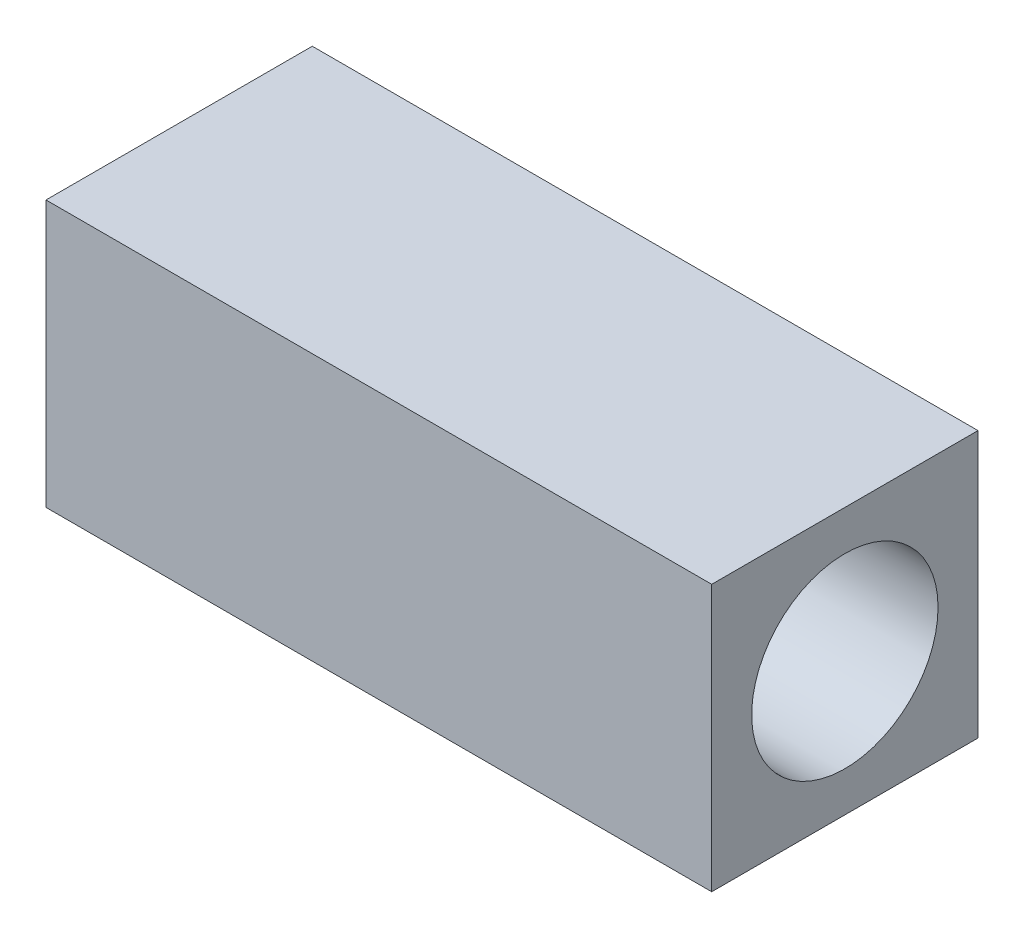
from build123d import *

# Parameters (mm, degrees)
CROQUIS1_W              = 1000
CROQUIS1_H              = 400
SALIENTE_EXTRUIR1_DEPTH = 400
CROQUIS2_R              = 140
CORTAR_EXTRUIR1_DEPTH   = 1000


with BuildPart() as part:
    # Croquis1 → Saliente-Extruir1 (new body)
    with BuildSketch(Plane.XY):
        with Locations((500, 200)):
            Rectangle(CROQUIS1_W, CROQUIS1_H)
    extrude(amount=SALIENTE_EXTRUIR1_DEPTH)

    # Croquis2 → Cortar-Extruir1 (cut)
    with BuildSketch(Plane(origin=(1000, 0, 0), x_dir=(0, 0, -1), z_dir=(1, 0, 0))):
        with Locations((-200, 200)):
            Circle(CROQUIS2_R)
    extrude(amount=-CORTAR_EXTRUIR1_DEPTH, mode=Mode.SUBTRACT)


solid = part.part
